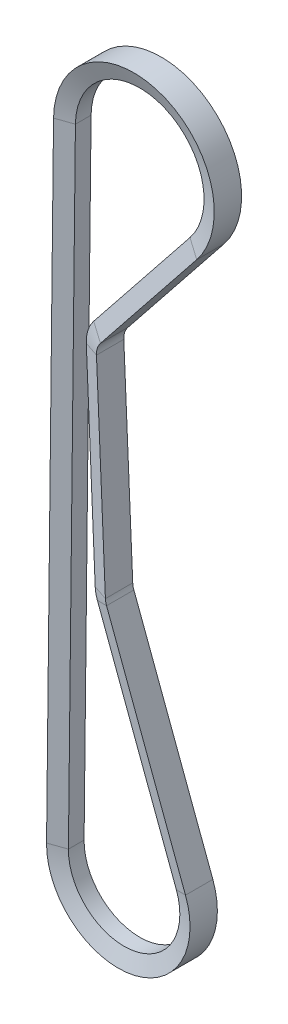
from build123d import *


with BuildPart() as part:
    # Sweep1: sweep along a path in Sketch2
    with BuildLine(Plane.XY) as sweep1_path:
        Line((27.320822024, 202.46405137), (-6.222828847, 160.445011667))
        ThreePointArc((-6.222828847, 160.445011667), (-7.297260863, 158.452183107), (-7.604264464, 156.209078425))
        Line((-7.604264464, 156.209078425), (-4.494355109, 84.276273226))
        ThreePointArc((-4.494355109, 84.276273226), (-4.373015172, 83.285605937), (-4.097946038, 82.326188391))
        Line((-4.097946038, 82.326188391), (23.41600284, 8.757328988))
        ThreePointArc((23.41600284, 8.757328988), (4.313292744, -24.6250991), (-24.998463945, 0.277128871))
        Line((-24.998463945, 0.277128871), (-22.559956636, 220.243157343))
        ThreePointArc((-22.559956636, 220.243157343), (14.839112593, 246.307479731), (27.320822024, 202.46405137))
    # Sketch3 → Sweep1 (sweep)
    with BuildSketch(Plane(origin=(23.41600284, 8.757328988, 0), x_dir=(0, 0, -1), z_dir=(0.3502931595188303, -0.9366401135944986, 0))):
        Polygon((-4.7625, 0), (4.7625, 0), (2.728634331, -5.588), (-2.728634331, -5.588), align=None)
    sweep(path=sweep1_path.line)


solid = part.part
